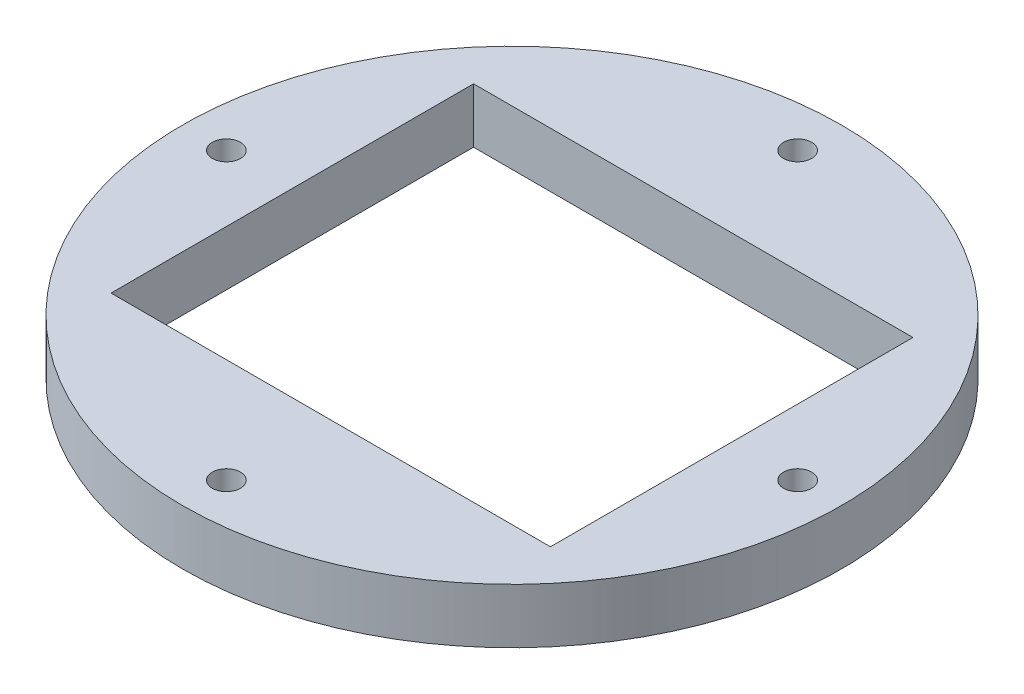
from build123d import *

# Parameters (mm, degrees)
SKETCH1_R           = 38.1
SKETCH1_R_2         = 1.6256
SKETCH1_W           = 50.8
SKETCH1_H           = 41.91
BOSS_EXTRUDE1_DEPTH = 6.35


with BuildPart() as part:
    # Sketch1 → Boss-Extrude1 (new body)
    with BuildSketch(Plane(origin=(0, 0, 0), x_dir=(1, 0, 0), z_dir=(0, 1, 0))):
        Circle(SKETCH1_R)
        with Locations((0, 33.02)):
            Circle(SKETCH1_R_2, mode=Mode.SUBTRACT)
        with Locations((33.02, 0)):
            Circle(SKETCH1_R_2, mode=Mode.SUBTRACT)
        with Locations((0, -33.02)):
            Circle(SKETCH1_R_2, mode=Mode.SUBTRACT)
        with Locations((-33.02, 0)):
            Circle(SKETCH1_R_2, mode=Mode.SUBTRACT)
        Rectangle(SKETCH1_W, SKETCH1_H, mode=Mode.SUBTRACT)
    extrude(amount=BOSS_EXTRUDE1_DEPTH)


solid = part.part
